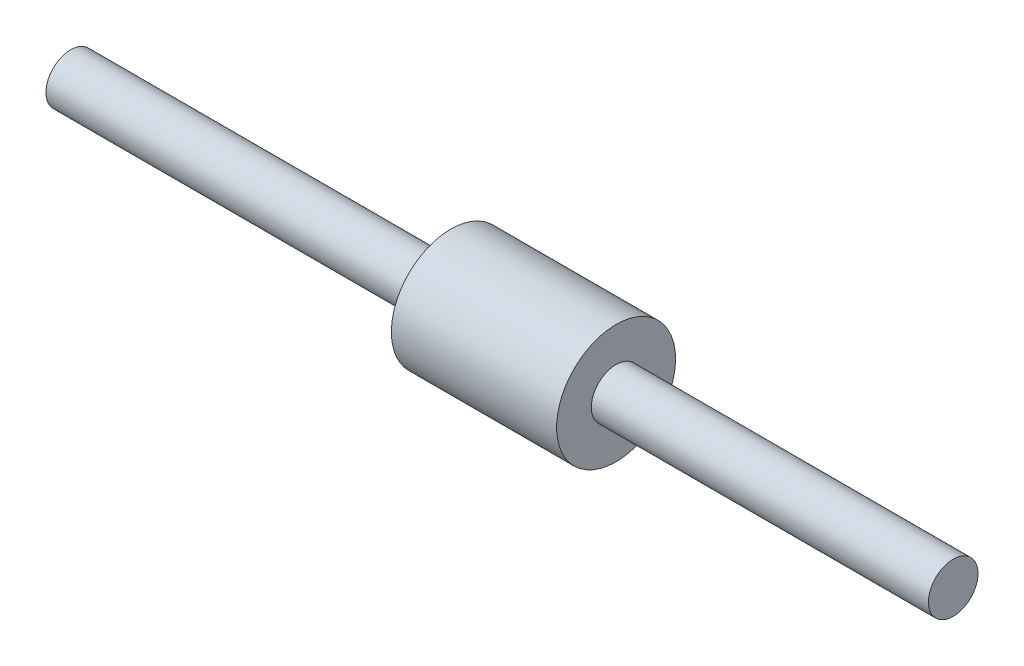
from build123d import *


with BuildPart() as part:
    # Sketch1 → Revolve1 (revolve)
    with BuildSketch(Plane.XY):
        Polygon((127, 0), (127, 7.5), (25, 7.5), (25, 18), (-25, 18), (-25, 7.5), (-140, 7.5), (-140, 5.5), (-127, 5.5), (-127, 0), align=None)
    revolve(axis=Axis((196.356223274, 0, 0), (-1, 0, 0)))


solid = part.part
